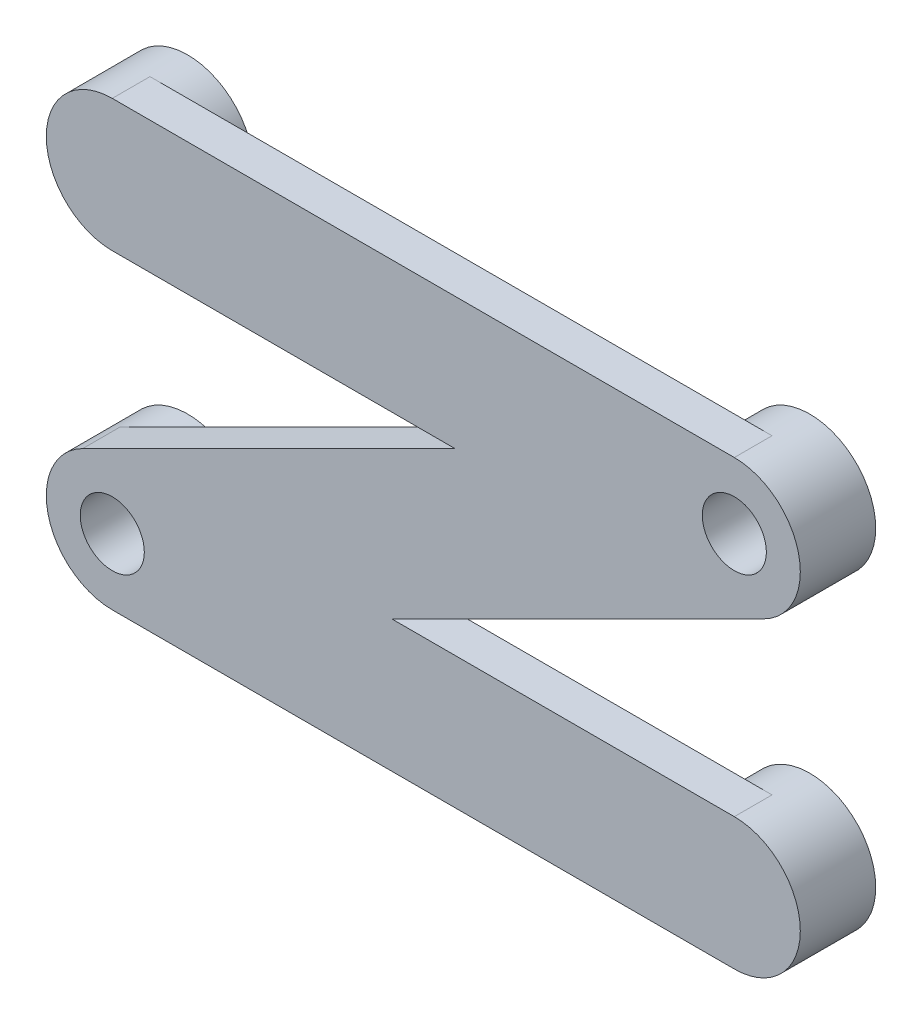
from build123d import *

# Parameters (mm, degrees)
EXTRUDE_916_DEPTH = 2
SKETCH_1_3_R      = 3.5
SKETCH_1_3_R_2    = 1.7
EXTRUDE_988_DEPTH = 4


with BuildPart() as part:
    # Эскиз1 → Extrude 916 (new body)
    with BuildSketch(Plane.XY):
        with BuildLine():
            Line((16.5, 11.75), (-16.5, 11.75))
            ThreePointArc((-16.5, 11.75), (-14.025126266, 10.724873734), (-13, 8.25))
            ThreePointArc((-13, 8.25), (-14.025126266, 5.775126266), (-16.5, 4.75))
            Line((-16.5, 4.75), (1.673762079, 4.75))
            Line((1.673762079, 4.75), (-18.065247584, -5.119504832))
            ThreePointArc((-18.065247584, -5.119504832), (-14.659941108, -5.272722171), (-13, -8.25))
            ThreePointArc((-13, -8.25), (-14.025126266, -10.724873734), (-16.5, -11.75))
            Line((-16.5, -11.75), (16.5, -11.75))
            ThreePointArc((16.5, -11.75), (13, -8.25), (16.5, -4.75))
            Line((16.5, -4.75), (-1.673762079, -4.75))
            Line((-1.673762079, -4.75), (18.065247584, 5.119504832))
            ThreePointArc((18.065247584, 5.119504832), (13.093628537, 7.445864778), (16.5, 11.75))
        make_face()
    extrude(amount=-EXTRUDE_916_DEPTH)

    # Эскиз1<3> → Extrude 988 (add)
    # profile 1 of 4: a face of its own
    with BuildSketch(Plane.XY):
        with Locations((-16.5, 8.25)):
            Circle(SKETCH_1_3_R)
    # profile 2 of 4: a face of its own
    with BuildSketch(Plane.XY):
        with Locations((16.5, 8.25)):
            Circle(SKETCH_1_3_R)
        with Locations((16.5, 8.25)):
            Circle(SKETCH_1_3_R_2, mode=Mode.SUBTRACT)
    # profile 3 of 4: a face of its own
    with BuildSketch(Plane.XY):
        with Locations((-16.5, -8.25)):
            Circle(SKETCH_1_3_R)
        with Locations((-16.5, -8.25)):
            Circle(SKETCH_1_3_R_2, mode=Mode.SUBTRACT)
    # profile 4 of 4: a face of its own
    with BuildSketch(Plane.XY):
        with Locations((16.5, -8.25)):
            Circle(SKETCH_1_3_R)
    extrude(amount=-EXTRUDE_988_DEPTH)


solid = part.part
